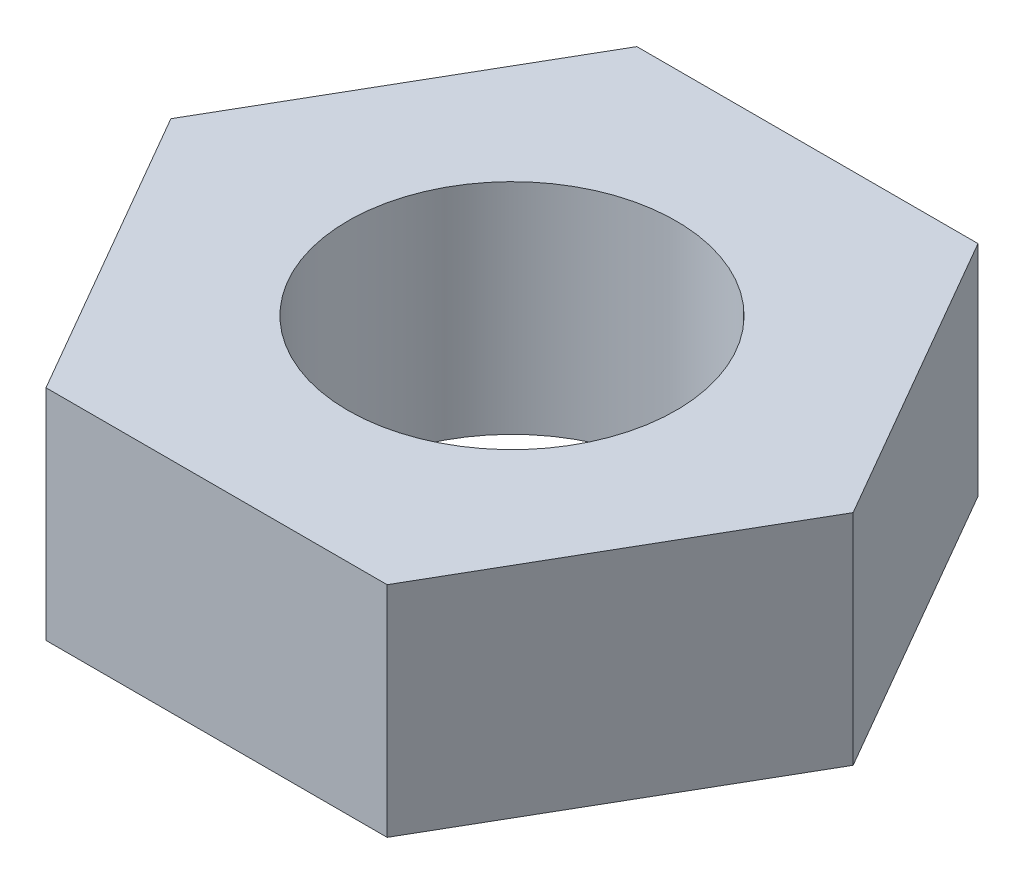
from build123d import *

# Parameters (mm, degrees)
SKETCH1_R           = 1.5
BOSS_EXTRUDE1_DEPTH = 2


with BuildPart() as part:
    # Sketch1 → Boss-Extrude1 (new body)
    with BuildSketch(Plane(origin=(0, 0, 0), x_dir=(1, 0, 0), z_dir=(0, 1, 0))):
        Polygon((-3.117691454, 0), (-1.558845727, -2.7), (1.558845727, -2.7), (3.117691454, 0), (1.558845727, 2.7), (-1.558845727, 2.7), align=None)
        Circle(SKETCH1_R, mode=Mode.SUBTRACT)
    extrude(amount=BOSS_EXTRUDE1_DEPTH)


solid = part.part
